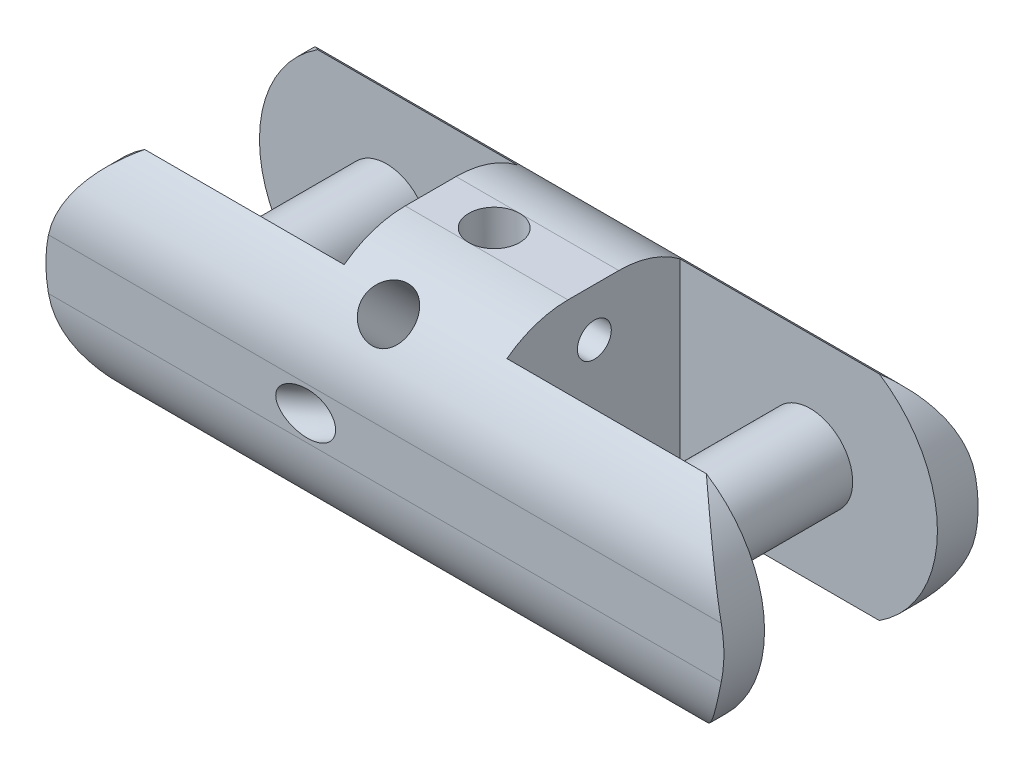
from build123d import *

# Parameters (mm, degrees)
BOSS_EXTRUDE1_DEPTH  = 40
SKETCH3_W            = 15.2
SKETCH3_H            = 3.6
SKETCH3_H_2          = 1.5
CUT_EXTRUDE1_DEPTH   = 15
SKETCH4_R            = 2.5
BOSS_EXTRUDE2_DEPTH  = 10.2
CUT_EXTRUDE4_START   = -15
CUT_EXTRUDE4_DEPTH   = 15
CAVITY2_START        = 15.2
CAVITY2_OUTLINE_R    = 1
CAVITY2_DEPTH        = 9.6
CUT_SWEEP1_PROFILE_R = 1.25
SKETCH33_R           = 1.5
CUT_EXTRUDE6_DEPTH   = 10
SKETCH34_R           = 1.5
CUT_EXTRUDE7_DEPTH   = 20


# Read off the part's stored shape, not the designer's step: Cut-Extrude4, Cavity2
with BuildPart() as part:
    # Sketch1 → Boss-Extrude1 (new body)
    with BuildSketch(Plane(origin=(0, 0, 0), x_dir=(0, 0, -1), z_dir=(1, 0, 0))):
        with BuildLine():
            Line((-1.5, -7.5), (1.5, -7.5))
            ThreePointArc((1.5, -7.5), (5.742640687, -5.742640687), (7.5, -1.5))
            Line((7.5, -1.5), (7.5, 1.5))
            ThreePointArc((7.5, 1.5), (5.742640687, 5.742640687), (1.5, 7.5))
            Line((1.5, 7.5), (-1.5, 7.5))
            ThreePointArc((-1.5, 7.5), (-5.742640687, 5.742640687), (-7.5, 1.5))
            Line((-7.5, 1.5), (-7.5, -1.5))
            ThreePointArc((-7.5, -1.5), (-5.742640687, -5.742640687), (-1.5, -7.5))
        make_face()
    extrude(amount=BOSS_EXTRUDE1_DEPTH)

    # Sketch3 → Cut-Extrude1 (cut)
    with BuildSketch(Plane(origin=(0, 7.5, 0), x_dir=(1, 0, 0), z_dir=(0, 1, 0))):
        with Locations((32.4, 3.3)):
            Rectangle(SKETCH3_W, SKETCH3_H)
        with Locations((32.4, 0.75)):
            Rectangle(SKETCH3_W, SKETCH3_H_2)
        with Locations((32.4, -0.75)):
            Rectangle(SKETCH3_W, SKETCH3_H_2)
        with Locations((32.4, -3.3)):
            Rectangle(SKETCH3_W, SKETCH3_H)
    cut_extrude1 = extrude(amount=-CUT_EXTRUDE1_DEPTH, mode=Mode.SUBTRACT)

    # Sketch4 → Boss-Extrude2 (add)
    with BuildSketch(Plane(origin=(0, 0, 5.1), x_dir=(-1, 0, 0), z_dir=(0, 0, -1))):
        with Locations((-32.5, 0)):
            Circle(SKETCH4_R)
    boss_extrude2 = extrude(amount=BOSS_EXTRUDE2_DEPTH)

    # Mirror1: Cut-Extrude1, Boss-Extrude2 across plane
    add(cut_extrude1.mirror(Plane(origin=(20, 0, 0), x_dir=(0, 0, 1), z_dir=(1, 0, 0))), mode=Mode.SUBTRACT)
    add(boss_extrude2.mirror(Plane(origin=(20, 0, 0), x_dir=(0, 0, 1), z_dir=(1, 0, 0))))

    # Cut-Extrude4 outline → Cut-Extrude4 (cut)
    with BuildSketch(Plane(origin=(0, 0, -7.5), x_dir=(-1, 0, 0), z_dir=(0, 0, -1)).offset(CUT_EXTRUDE4_START)):
        with BuildLine():
            ThreePointArc((-40, 1e-09), (-37.803300859, 5.303300859), (-32.5, 7.5))
            Line((-32.5, 7.5), (-40, 7.5))
            Line((-40, 7.5), (-40, 1e-09))
        make_face()
        with BuildLine():
            ThreePointArc((-32.5, -7.5), (-37.803300859, -5.303300859), (-40, 1e-09))
            Line((-40, 1e-09), (-40, -7.5))
            Line((-40, -7.5), (-32.5, -7.5))
        make_face()
    cut_extrude4 = extrude(amount=CUT_EXTRUDE4_DEPTH, mode=Mode.SUBTRACT)

    # Mirror3: Cut-Extrude4 across plane
    add(cut_extrude4.mirror(Plane(origin=(20, 0, 0), x_dir=(0, 0, 1), z_dir=(1, 0, 0))), mode=Mode.SUBTRACT)

    # Cavity2 outline → Cavity2 (cut)
    with BuildSketch(Plane.YZ.offset(CAVITY2_START)):
        with Locations((4.683305038, -0.058543958)):
            Circle(CAVITY2_OUTLINE_R)
        with Locations((-4.623251354, -0.058543958)):
            Circle(CAVITY2_OUTLINE_R)
    extrude(amount=CAVITY2_DEPTH, mode=Mode.SUBTRACT)

    # Cut-Sweep1: sweep along a curve in space
    with BuildLine() as cut_sweep1_path:
        ThreePointArc((7.699002579, 0, 10.768233881), (18.468233927, 0, 0), (7.699002579, 0, -10.768233881))
    # Cut-Sweep1 profile (on start of the path) → Cut-Sweep1 (sweep, cut)
    with BuildSketch(Plane(origin=(7.699002579, 0, 10.768233881), x_dir=(-9.262620590308739e-05, 0, 0.999999995710193), z_dir=(0.999999995710193, 0, 9.262620590308739e-05))):
        Circle(CUT_SWEEP1_PROFILE_R)
    sweep(path=cut_sweep1_path.line, mode=Mode.SUBTRACT)

    # Sketch33 → Cut-Extrude6 (cut, symmetric)
    with BuildSketch(Plane(origin=(0, 4.5, 4.5), x_dir=(-1, 0, 0), z_dir=(0, -0.7071067811865448, -0.7071067811865502))):
        with Locations(Location((-18.411308254, 0, 0), (0, 0, 90))):
            Circle(SKETCH33_R)
    extrude(amount=CUT_EXTRUDE6_DEPTH, both=True, mode=Mode.SUBTRACT)

    # Sketch34 → Cut-Extrude7 (cut)
    with BuildSketch(Plane(origin=(0, 7.5, 0), x_dir=(1, 0, 0), z_dir=(0, 1, 0))):
        with Locations(Location((18.95, 0, 0), (0, 0, 270))):
            Circle(SKETCH34_R)
    extrude(amount=-CUT_EXTRUDE7_DEPTH, mode=Mode.SUBTRACT)


solid = part.part
